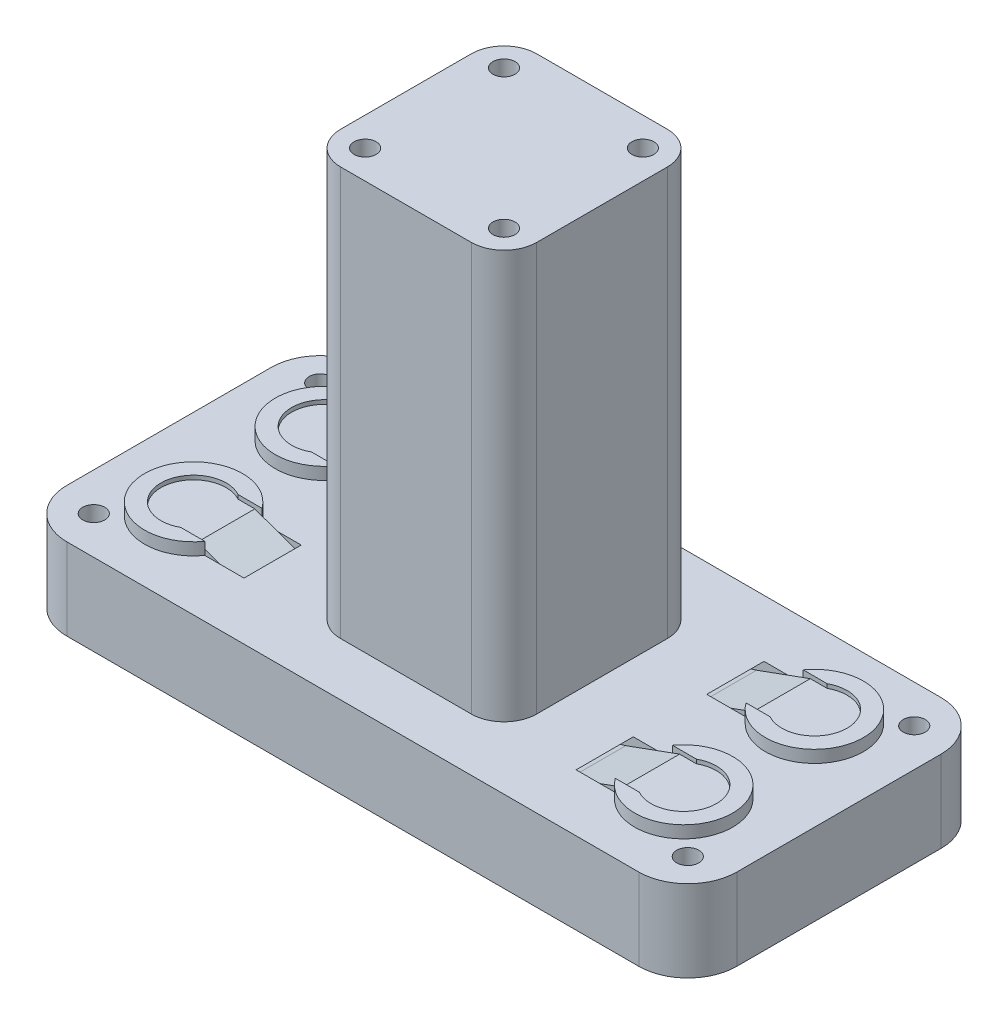
from build123d import *

# Parameters (mm, degrees)
BOSS_EXTRUDE1_DEPTH                        = 10
BOSS_EXTRUDE2_START                        = 10
SKETCH4_R                                  = 4
BOSS_EXTRUDE2_DEPTH                        = 1
BOSS_EXTRUDE4_START                        = 11.5
BOSS_EXTRUDE4_DEPTH                        = 7
CUT_EXTRUDE2_START                         = 11.5
CUT_EXTRUDE2_DEPTH                         = 7
BOSS_EXTRUDE3_START                        = 10
BOSS_EXTRUDE3_DEPTH                        = 1.5
MIRROR4_DEPTH                              = 8
MIRROR4_START                              = 8
MIRROR4_2_DEPTH                            = 2
MIRROR4_START_2                            = 10
MIRROR4_3_DEPTH                            = 1.5
MIRROR4_4_DEPTH                            = 3
MIRROR4_START_3                            = -11.5
MIRROR4_5_DEPTH                            = 7
MIRROR4_START_4                            = 4.5
MIRROR4_6_DEPTH                            = 7
SKETCH2_R                                  = 4.5
SKETCH2_W                                  = 40
SKETCH2_H                                  = 10
CUT_EXTRUDE1_DEPTH                         = 5
BOSS_EXTRUDE5_START                        = 10
BOSS_EXTRUDE5_DEPTH                        = 50
SKETCH8_R                                  = 1.35
CUT_EXTRUDE3_DEPTH                         = 4
SKETCH9_R                                  = 1.35
CUT_EXTRUDE4_DEPTH                         = 4
MIRROR5_AT_THE_SECOND_PLANE_COPY_1_SKETC_R = 1.35
MIRROR5_AT_THE_SECOND_PLANE_COPY_1_DEPTH   = 4


with BuildPart() as part:
    # Sketch3 → Boss-Extrude1 (new body)
    with BuildSketch(Plane(origin=(0, 0, 0), x_dir=(1, 0, 0), z_dir=(0, 1, 0))):
        with BuildLine():
            Line((-41, 0), (-41, -12.5))
            ThreePointArc((-41, -12.5), (-39.242640687, -16.742640687), (-35, -18.5))
            Line((-35, -18.5), (0, -18.5))
            Line((0, -18.5), (0, 0))
            Line((0, 0), (-41, 0))
        make_face()
    extrude(amount=BOSS_EXTRUDE1_DEPTH)

    # Sketch4 → Boss-Extrude2 (add)
    with BuildSketch(Plane(origin=(0, 0, 0), x_dir=(1, 0, 0), z_dir=(0, 1, 0)).offset(BOSS_EXTRUDE2_START)):
        with Locations((-30, -8)):
            Circle(SKETCH4_R)
        with BuildLine():
            Line((-26, -4.5), (-28.063508327, -4.5))
            ThreePointArc((-28.063508327, -4.5), (-26.554280431, -5.968493994), (-26, -8))
            Line((-26, -8), (-26, -4.5))
        make_face()
        with BuildLine():
            Line((-26, -11.5), (-26, -8))
            ThreePointArc((-26, -8), (-26.554280431, -10.031506006), (-28.063508327, -11.5))
            Line((-28.063508327, -11.5), (-26, -11.5))
        make_face()
    extrude(amount=BOSS_EXTRUDE2_DEPTH)

    # Sketch6 → Boss-Extrude4 (add)
    with BuildSketch(Plane.XY.offset(BOSS_EXTRUDE4_START)):
        Polygon((-23.252522581, 10), (-26, 11), (-26, 10), align=None)
    extrude(amount=-BOSS_EXTRUDE4_DEPTH)

    # Sketch6<3> → Cut-Extrude2 (cut)
    with BuildSketch(Plane.XY.offset(CUT_EXTRUDE2_START)):
        with BuildLine():
            Line((-20.32871818, 10), (-23.252522581, 10))
            Line((-23.252522581, 10), (-19.414499368, 8.603073792))
            ThreePointArc((-19.414499368, 8.603073792), (-17.730779711, 8.15192247), (-15.994297935, 8))
            Line((-15.994297935, 8), (0, 8))
            Line((0, 8), (0, 9))
            Line((0, 9), (-15.994297935, 9))
            ThreePointArc((-15.994297935, 9), (-17.557131534, 9.136730223), (-19.072479224, 9.542766413))
            Line((-19.072479224, 9.542766413), (-20.32871818, 10))
        make_face()
    extrude(amount=-CUT_EXTRUDE2_DEPTH, mode=Mode.SUBTRACT)

    # Sketch4<3> → Boss-Extrude3 (add)
    with BuildSketch(Plane(origin=(0, 0, 0), x_dir=(1, 0, 0), z_dir=(0, 1, 0)).offset(BOSS_EXTRUDE3_START)):
        with BuildLine():
            ThreePointArc((-28.063508327, -11.5), (-34, -8), (-28.063508327, -4.5))
            Line((-28.063508327, -4.5), (-26, -4.5))
            Line((-26, -4.5), (-25.126602828, -4.5))
            ThreePointArc((-25.126602828, -4.5), (-36, -8), (-25.126602828, -11.5))
            Line((-25.126602828, -11.5), (-26, -11.5))
            Line((-26, -11.5), (-28.063508327, -11.5))
        make_face()
    extrude(amount=BOSS_EXTRUDE3_DEPTH)

    # Mirror4: read off the stored shape, not the designer's step
    # Mirror4 outline → Mirror4 (add)
    with BuildSketch(Plane(origin=(0, 0, 0), x_dir=(1, 0, 0), z_dir=(0, 1, 0))):
        with BuildLine():
            Line((0, -18.5), (35, -18.5))
            ThreePointArc((35, -18.5), (39.242640687, -16.742640687), (41, -12.5))
            Line((41, -12.5), (41, 12.5))
            ThreePointArc((41, 12.5), (39.242640687, 16.742640687), (35, 18.5))
            Line((35, 18.5), (-35, 18.5))
            ThreePointArc((-35, 18.5), (-39.242640687, 16.742640687), (-41, 12.5))
            Line((-41, 12.5), (-41, 0))
            Line((-41, 0), (0, 0))
            Line((0, 0), (0, -18.5))
        make_face()
    extrude(amount=MIRROR4_DEPTH)

    # Mirror4 2 outline → Mirror4 2 (add)
    with BuildSketch(Plane(origin=(0, 0, 0), x_dir=(1, 0, 0), z_dir=(0, 1, 0)).offset(MIRROR4_START)):
        with BuildLine():
            Line((0, -11.5), (0, -18.5))
            Line((0, -18.5), (35, -18.5))
            ThreePointArc((35, -18.5), (39.242640687, -16.742640687), (41, -12.5))
            Line((41, -12.5), (41, 12.5))
            ThreePointArc((41, 12.5), (39.242640687, 16.742640687), (35, 18.5))
            Line((35, 18.5), (-35, 18.5))
            ThreePointArc((-35, 18.5), (-39.242640687, 16.742640687), (-41, 12.5))
            Line((-41, 12.5), (-41, 0))
            Line((-41, 0), (0, 0))
            Line((0, 0), (0, -4.5))
            Line((0, -4.5), (28.063508327, -4.5))
            ThreePointArc((28.063508327, -4.5), (34, -8), (28.063508327, -11.5))
            Line((28.063508327, -11.5), (0, -11.5))
        make_face()
        with BuildLine():
            ThreePointArc((28.063508327, 11.5), (34, 8), (28.063508327, 4.5))
            Line((28.063508327, 4.5), (-28.063508327, 4.5))
            ThreePointArc((-28.063508327, 4.5), (-34, 8), (-28.063508327, 11.5))
            Line((-28.063508327, 11.5), (28.063508327, 11.5))
        make_face(mode=Mode.SUBTRACT)
    extrude(amount=MIRROR4_2_DEPTH)

    # Mirror4 3 outline → Mirror4 3 (add)
    with BuildSketch(Plane(origin=(0, 0, 0), x_dir=(1, 0, 0), z_dir=(0, 1, 0)).offset(MIRROR4_START_2)):
        with BuildLine():
            Line((28.063508327, -11.5), (25.126602828, -11.5))
            ThreePointArc((25.126602828, -11.5), (36, -8), (25.126602828, -4.5))
            Line((25.126602828, -4.5), (28.063508327, -4.5))
            ThreePointArc((28.063508327, -4.5), (34, -8), (28.063508327, -11.5))
        make_face()
        with BuildLine():
            Line((-28.063508327, 11.5), (-25.126602828, 11.5))
            ThreePointArc((-25.126602828, 11.5), (-36, 8), (-25.126602828, 4.5))
            Line((-25.126602828, 4.5), (-28.063508327, 4.5))
            ThreePointArc((-28.063508327, 4.5), (-34, 8), (-28.063508327, 11.5))
        make_face()
        with BuildLine():
            ThreePointArc((25.126602828, 4.5), (36, 8), (25.126602828, 11.5))
            Line((25.126602828, 11.5), (28.063508327, 11.5))
            ThreePointArc((28.063508327, 11.5), (34, 8), (28.063508327, 4.5))
            Line((28.063508327, 4.5), (25.126602828, 4.5))
        make_face()
    extrude(amount=MIRROR4_3_DEPTH)

    # Mirror4 4 outline → Mirror4 4 (add)
    with BuildSketch(Plane(origin=(0, 0, 0), x_dir=(1, 0, 0), z_dir=(0, 1, 0)).offset(MIRROR4_START)):
        with BuildLine():
            Line((0, -11.5), (28.063508327, -11.5))
            ThreePointArc((28.063508327, -11.5), (34, -8), (28.063508327, -4.5))
            Line((28.063508327, -4.5), (0, -4.5))
            Line((0, -4.5), (0, -11.5))
        make_face()
        with BuildLine():
            Line((28.063508327, 11.5), (-28.063508327, 11.5))
            ThreePointArc((-28.063508327, 11.5), (-34, 8), (-28.063508327, 4.5))
            Line((-28.063508327, 4.5), (28.063508327, 4.5))
            ThreePointArc((28.063508327, 4.5), (34, 8), (28.063508327, 11.5))
        make_face()
    extrude(amount=MIRROR4_4_DEPTH)

    # Mirror4 5 outline → Mirror4 5 (cut)
    with BuildSketch(Plane.XY.offset(MIRROR4_START_3)):
        with BuildLine():
            Line((26, 11), (-26, 11))
            Line((-26, 11), (-19.414499368, 8.603073792))
            ThreePointArc((-19.414499368, 8.603073792), (-17.730779711, 8.15192247), (-15.994297935, 8))
            Line((-15.994297935, 8), (15.994297935, 8))
            ThreePointArc((15.994297935, 8), (17.730779711, 8.15192247), (19.414499368, 8.603073792))
            Line((19.414499368, 8.603073792), (26, 11))
        make_face()
        with BuildLine():
            Line((20.32871818, 10), (19.072479224, 9.542766413))
            ThreePointArc((19.072479224, 9.542766413), (17.557131534, 9.136730223), (15.994297935, 9))
            Line((15.994297935, 9), (-15.994297935, 9))
            ThreePointArc((-15.994297935, 9), (-17.557131534, 9.136730223), (-19.072479224, 9.542766413))
            Line((-19.072479224, 9.542766413), (-20.32871818, 10))
            Line((-20.32871818, 10), (20.32871818, 10))
        make_face(mode=Mode.SUBTRACT)
    extrude(amount=MIRROR4_5_DEPTH, mode=Mode.SUBTRACT)

    # Mirror4 6 outline → Mirror4 6 (cut)
    with BuildSketch(Plane.XY.offset(MIRROR4_START_4)):
        with BuildLine():
            Line((0, 10), (20.32871818, 10))
            Line((20.32871818, 10), (19.072479224, 9.542766413))
            ThreePointArc((19.072479224, 9.542766413), (17.557131534, 9.136730223), (15.994297935, 9))
            Line((15.994297935, 9), (0, 9))
            Line((0, 9), (0, 8))
            Line((0, 8), (15.994297935, 8))
            ThreePointArc((15.994297935, 8), (17.730779711, 8.15192247), (19.414499368, 8.603073792))
            Line((19.414499368, 8.603073792), (26, 11))
            Line((26, 11), (0, 11))
            Line((0, 11), (0, 10))
        make_face()
    extrude(amount=MIRROR4_6_DEPTH, mode=Mode.SUBTRACT)

    # Sketch2 → Cut-Extrude1 (cut)
    with BuildSketch(Plane(origin=(0, 0, 0), x_dir=(1, 0, 0), z_dir=(0, 1, 0))):
        with Locations(Location((-30, 0, 0), (0, 0, 270))):
            Circle(SKETCH2_R)
        with Locations(Location((30, 0, 0), (0, 0, 270))):
            Circle(SKETCH2_R)
        Rectangle(SKETCH2_W, SKETCH2_H)
    extrude(amount=CUT_EXTRUDE1_DEPTH, mode=Mode.SUBTRACT)

    # Sketch7 → Boss-Extrude5 (add)
    with BuildSketch(Plane(origin=(0, 0, 0), x_dir=(1, 0, 0), z_dir=(0, 1, 0)).offset(BOSS_EXTRUDE5_START)):
        with BuildLine():
            Line((-8, -12), (8, -12))
            ThreePointArc((8, -12), (10.828427125, -10.828427125), (12, -8))
            Line((12, -8), (12, 8))
            ThreePointArc((12, 8), (10.828427125, 10.828427125), (8, 12))
            Line((8, 12), (-8, 12))
            ThreePointArc((-8, 12), (-10.828427125, 10.828427125), (-12, 8))
            Line((-12, 8), (-12, -8))
            ThreePointArc((-12, -8), (-10.828427125, -10.828427125), (-8, -12))
        make_face()
    extrude(amount=BOSS_EXTRUDE5_DEPTH)

    # Sketch8 → Cut-Extrude3 (cut)
    with BuildSketch(Plane(origin=(0, 60, 0), x_dir=(1, 0, 0), z_dir=(0, 1, 0))):
        with Locations(Location((-8.5, 8.5, 0), (0, 0, 270))):
            Circle(SKETCH8_R)
        with Locations(Location((-8.5, -8.5, 0), (0, 0, 270))):
            Circle(SKETCH8_R)
        with Locations(Location((8.5, 8.5, 0), (0, 0, 270))):
            Circle(SKETCH8_R)
        with Locations(Location((8.5, -8.5, 0), (0, 0, 270))):
            Circle(SKETCH8_R)
    extrude(amount=-CUT_EXTRUDE3_DEPTH, mode=Mode.SUBTRACT)

    # Sketch9 → Cut-Extrude4 (cut)
    with BuildSketch(Plane(origin=(0, 10, 0), x_dir=(1, 0, 0), z_dir=(0, 1, 0))):
        with Locations(Location((-36.36, 13.86, 0), (0, 0, 270))):
            Circle(SKETCH9_R)
    cut_extrude4 = extrude(amount=-CUT_EXTRUDE4_DEPTH, mode=Mode.SUBTRACT)

    # Mirror5: Cut-Extrude4 across plane
    add(cut_extrude4.mirror(Plane.XY), mode=Mode.SUBTRACT)

    # Mirror5 at the second plane: Cut-Extrude4 across plane
    add(cut_extrude4.mirror(Plane(origin=(0, 0, 0), x_dir=(0, 0, 1), z_dir=(1, 0, 0))), mode=Mode.SUBTRACT)

    # Mirror5 at the second plane copy 1 sketc → Mirror5 at the second plane copy 1 (cut)
    with BuildSketch(Plane(origin=(0, 10, 0), x_dir=(-1, 0, 0), z_dir=(0, 1, 0))):
        with Locations(Location((-36.36, 13.86, 0), (0, 0, 270))):
            Circle(MIRROR5_AT_THE_SECOND_PLANE_COPY_1_SKETC_R)
    extrude(amount=-MIRROR5_AT_THE_SECOND_PLANE_COPY_1_DEPTH, mode=Mode.SUBTRACT)


solid = part.part
